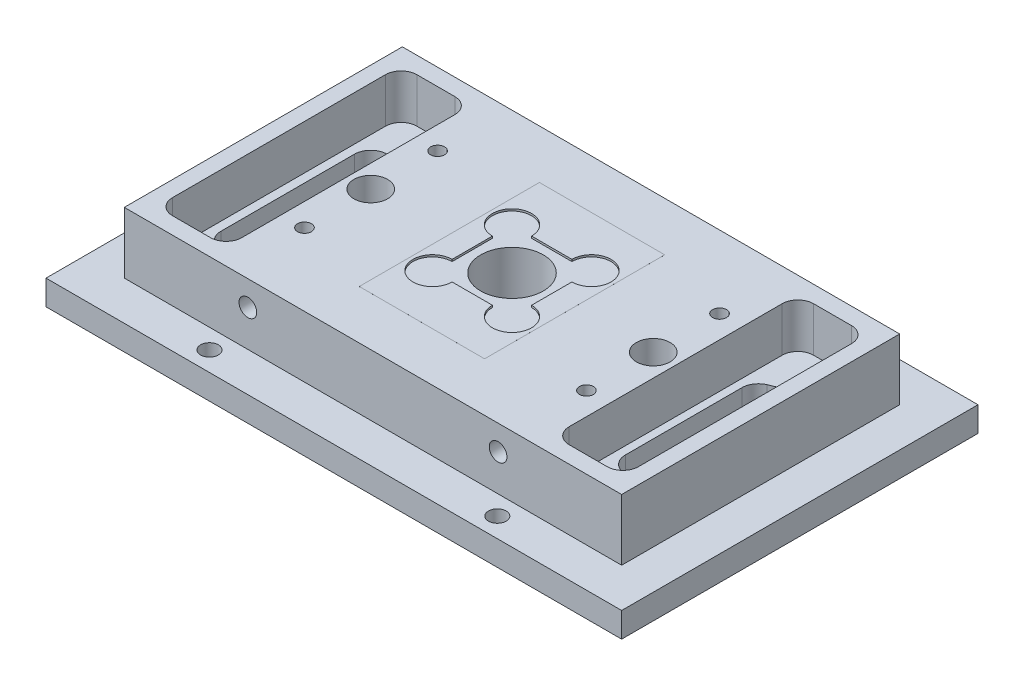
from build123d import *

# Parameters (mm, degrees)
MAIN_SKETCH_W                         = 73.5
MAIN_SKETCH_H                         = 45.5
MAIN_SKETCH_W_2                       = 63.5
MAIN_SKETCH_H_2                       = 35.5
LIP_DEPTH                             = 3.175
MOUNTING_BASE_OUTLINE_W               = 63.5
MOUNTING_BASE_OUTLINE_H               = 35.5
MOUNTING_BASE_OUTLINE_R               = 2.15265
MOUNTING_BASE_OUTLINE_R_2             = 4
MOUNTING_BASE_DEPTH                   = 11
HEATER_CART_4_40_TAPS_D               = 2.2606
HEATER_CART_4_40_TAPS_DEPTH           = 7.595
HEATER_CART_4_40_TAPS_TIP             = 0.679152758
HEATER_CART_4_40_TAPS_ON_FACE_2_D     = 2.2606
HEATER_CART_4_40_TAPS_ON_FACE_2_DEPTH = 7.595
HEATER_CART_4_40_TAPS_ON_FACE_2_TIP   = 0.679152758
MAIN_SKETCH_12_W                      = 8.85
MAIN_SKETCH_12_H                      = 31.2
BOTTOM_SQUARE_CUTOUT_DEPTH            = 2
SQUARE_MICRO_D_CUTOUT_START           = 5.3
SQUARE_MICRO_D_CUTOUT_OUTLINE_W       = 8.85
SQUARE_MICRO_D_CUTOUT_OUTLINE_H       = 31.2
SQUARE_MICRO_D_CUTOUT_DEPTH           = 5.7
MAIN_SKETCH_7_R                       = 0.285
ROUND_MICRO_D_CUTOUT_DEPTH            = 11
INTERNAL_CORNER_CUTOUTS_FILLET_R      = 2
CHIP_CLAMP_0_80_TAPS_AT_2_COUNT       = 2
CHIP_CLAMP_0_80_TAPS_AT_2_PITCH       = 17.1232
CHIP_CLAMP_0_80_TAPS_AT_3_COUNT       = 2
CHIP_CLAMP_0_80_TAPS_AT_3_PITCH       = 17.1232
CHIP_POCKET_START                     = 11
MAIN_SKETCH_6_R                       = 2.5
MAIN_SKETCH_6_W                       = 10.15
MAIN_SKETCH_6_H                       = 10.15
CHIP_POCKET_DEPTH                     = 0.25
F_2_56_CLOSE_CLEAR_43_0_089_D         = 2.2606
PCB_2_56_TAPS_D                       = 1.778
PCB_2_56_TAPS_DEPTH                   = 5.734
PCB_2_56_TAPS_TIP                     = 0.53416509
BOTTOM_COVER_2_56_TAPS_D              = 1.778
BOTTOM_COVER_2_56_TAPS_DEPTH          = 5.734
BOTTOM_COVER_2_56_TAPS_TIP            = 0.53416509
F_2_56_TAPPED_HOLE1_D                 = 1.778
F_2_56_TAPPED_HOLE1_DEPTH             = 5.734
F_2_56_TAPPED_HOLE1_TIP               = 0.53416509
SUPRESS_START                         = 11.001
SKETCH14_W                            = 16
SKETCH14_H                            = 23
SUPRESS_IF_NOT_SIMULATING_DEPTH       = 0.001


# Read off the part's stored shape, not the designer's step: Mounting_Base, Square_Micro_D_Cutout
with BuildPart() as part:
    # Main_Sketch → Lip (new body)
    with BuildSketch(Plane(origin=(0, 0, 0), x_dir=(1, 0, 0), z_dir=(0, 1, 0))):
        with Locations((36.75, -22.75)):
            Rectangle(MAIN_SKETCH_W, MAIN_SKETCH_H)
        with Locations((36.75, -22.75)):
            Rectangle(MAIN_SKETCH_W_2, MAIN_SKETCH_H_2, mode=Mode.SUBTRACT)
    extrude(amount=LIP_DEPTH)

    # Mounting_Base outline → Mounting_Base (add)
    with BuildSketch(Plane(origin=(0, 0, 0), x_dir=(1, 0, 0), z_dir=(0, 1, 0))):
        with Locations((36.75, -22.75)):
            Rectangle(MOUNTING_BASE_OUTLINE_W, MOUNTING_BASE_OUTLINE_H)
        with Locations((18.716, -22.75)):
            Circle(MOUNTING_BASE_OUTLINE_R, mode=Mode.SUBTRACT)
        with Locations((36.75, -22.75)):
            Circle(MOUNTING_BASE_OUTLINE_R_2, mode=Mode.SUBTRACT)
        with Locations((54.784, -22.75)):
            Circle(MOUNTING_BASE_OUTLINE_R, mode=Mode.SUBTRACT)
    extrude(amount=MOUNTING_BASE_DEPTH)

    # Heater_Cart_#4-40_Taps
    with Locations(Plane(origin=(52.725, 7.825, 5), x_dir=(-1, 0, 0), z_dir=(0, 0, -1))):
        with Locations((0, 0), (31.95, 0)):
            Hole(HEATER_CART_4_40_TAPS_D / 2, depth=HEATER_CART_4_40_TAPS_DEPTH)
            with Locations((0, 0, -(HEATER_CART_4_40_TAPS_DEPTH + HEATER_CART_4_40_TAPS_TIP / 2))):  # 118° drill point
                Cone(0, HEATER_CART_4_40_TAPS_D / 2, HEATER_CART_4_40_TAPS_TIP, mode=Mode.SUBTRACT)

    # Heater_Cart_#4-40_Taps on face 2
    with Locations(Plane(origin=(20.775, 7.825, 40.5), x_dir=(1, 0, 0), z_dir=(0, 0, 1))):
        with Locations((0, 0), (31.95, 0)):
            Hole(HEATER_CART_4_40_TAPS_ON_FACE_2_D / 2, depth=HEATER_CART_4_40_TAPS_ON_FACE_2_DEPTH)
            with Locations((0, 0, -(HEATER_CART_4_40_TAPS_ON_FACE_2_DEPTH + HEATER_CART_4_40_TAPS_ON_FACE_2_TIP / 2))):  # 118° drill point
                Cone(0, HEATER_CART_4_40_TAPS_ON_FACE_2_D / 2, HEATER_CART_4_40_TAPS_ON_FACE_2_TIP, mode=Mode.SUBTRACT)

    # Main_Sketch<12> → Bottom_square_cutout (cut)
    with BuildSketch(Plane(origin=(0, 0, 0), x_dir=(1, 0, 0), z_dir=(0, 1, 0))):
        with Locations((11.425, -22.75)):
            Rectangle(MAIN_SKETCH_12_W, MAIN_SKETCH_12_H)
        with BuildLine():
            ThreePointArc((11.021574965, -33.196222286), (9.996212222, -33.351578951), (9.021946869, -32.996175702))
            ThreePointArc((9.021946869, -32.996175702), (8.351632057, -32.244424217), (8.109546604, -31.26675))
            Line((8.109546604, -31.26675), (8.109546604, -14.23325))
            ThreePointArc((8.109546604, -14.23325), (8.351632057, -13.255575783), (9.021946869, -12.503824298))
            ThreePointArc((9.021946869, -12.503824298), (9.996212222, -12.148421049), (11.021574965, -12.303777714))
            Line((11.021574965, -12.303777714), (13.554010046, -13.37581902))
            ThreePointArc((13.554010046, -13.37581902), (14.483840891, -14.148001292), (14.8324534, -15.305291306))
            Line((14.8324534, -15.305291306), (14.8324534, -30.194708694))
            ThreePointArc((14.8324534, -30.194708694), (14.483840891, -31.351998708), (13.554010046, -32.12418098))
            Line((13.554010046, -32.12418098), (11.021574965, -33.196222286))
        make_face(mode=Mode.SUBTRACT)
    bottom_square_cutout = extrude(amount=BOTTOM_SQUARE_CUTOUT_DEPTH, mode=Mode.SUBTRACT)

    # Square_Micro_D_Cutout outline → Square_Micro_D_Cutout (cut)
    with BuildSketch(Plane(origin=(0, 0, 0), x_dir=(1, 0, 0), z_dir=(0, 1, 0)).offset(SQUARE_MICRO_D_CUTOUT_START)):
        with Locations((11.425, -22.75)):
            Rectangle(SQUARE_MICRO_D_CUTOUT_OUTLINE_W, SQUARE_MICRO_D_CUTOUT_OUTLINE_H)
        with BuildLine():
            ThreePointArc((11.021574965, -33.196222286), (9.047492447, -33.013373348), (8.109546604, -31.26675))
            Line((8.109546604, -31.26675), (8.109546604, -14.23325))
            ThreePointArc((8.109546604, -14.23325), (9.047492447, -12.486626652), (11.021574965, -12.303777714))
            Line((11.021574965, -12.303777714), (13.554010046, -13.37581902))
            ThreePointArc((13.554010046, -13.37581902), (14.483840891, -14.148001291), (14.8324534, -15.305291306))
            Line((14.8324534, -15.305291306), (14.8324534, -30.194708694))
            ThreePointArc((14.8324534, -30.194708694), (14.483840891, -31.351998709), (13.554010046, -32.12418098))
            Line((13.554010046, -32.12418098), (11.021574965, -33.196222286))
        make_face(mode=Mode.SUBTRACT)
    square_micro_d_cutout = extrude(amount=SQUARE_MICRO_D_CUTOUT_DEPTH, mode=Mode.SUBTRACT)

    # Main_Sketch<7> → Round_Micro_D_Cutout (cut)
    # profile 1 of 2: a face of its own
    with BuildSketch(Plane(origin=(0, 0, 0), x_dir=(1, 0, 0), z_dir=(0, 1, 0))):
        with BuildLine():
            ThreePointArc((9.021946869, -32.996175702), (8.351632057, -32.244424217), (8.109546604, -31.26675))
            Line((8.109546604, -31.26675), (8.109546604, -14.23325))
            ThreePointArc((8.109546604, -14.23325), (8.351632057, -13.255575783), (9.021946869, -12.503824298))
            ThreePointArc((9.021946869, -12.503824298), (9.996212222, -12.148421049), (11.021574965, -12.303777714))
            Line((11.021574965, -12.303777714), (13.554010046, -13.37581902))
            ThreePointArc((13.554010046, -13.37581902), (14.483840891, -14.148001292), (14.8324534, -15.305291306))
            Line((14.8324534, -15.305291306), (14.8324534, -30.194708694))
            ThreePointArc((14.8324534, -30.194708694), (14.483840891, -31.351998708), (13.554010046, -32.12418098))
            Line((13.554010046, -32.12418098), (11.021574965, -33.196222286))
            ThreePointArc((11.021574965, -33.196222286), (9.996212222, -33.351578951), (9.021946869, -32.996175702))
        make_face()
        with Locations((10.899546604, -22.75)):
            Circle(MAIN_SKETCH_7_R, mode=Mode.SUBTRACT)
    # profile 2 of 2: a face of its own
    with BuildSketch(Plane(origin=(0, 0, 0), x_dir=(1, 0, 0), z_dir=(0, 1, 0))):
        with Locations((10.899546604, -22.75)):
            Circle(MAIN_SKETCH_7_R)
    round_micro_d_cutout = extrude(amount=ROUND_MICRO_D_CUTOUT_DEPTH, mode=Mode.SUBTRACT)

    # MicroD_Mirror: Bottom_square_cutout, Square_Micro_D_Cutout, Round_Micro_D_Cutout across plane
    add(bottom_square_cutout.mirror(Plane(origin=(36.75, 0, 0), x_dir=(0, 0, 1), z_dir=(1, 0, 0))), mode=Mode.SUBTRACT)
    add(square_micro_d_cutout.mirror(Plane(origin=(36.75, 0, 0), x_dir=(0, 0, 1), z_dir=(1, 0, 0))), mode=Mode.SUBTRACT)
    add(round_micro_d_cutout.mirror(Plane(origin=(36.75, 0, 0), x_dir=(0, 0, 1), z_dir=(1, 0, 0))), mode=Mode.SUBTRACT)

    # Internal_Corner_cutouts_fillet
    internal_corner_cutouts_fillet_edges = [part.edges().sort_by_distance(p)[0] for p in [
        (15.85, 8.15, 38.35),
        (7, 8.15, 38.35),
        (7, 8.15, 7.15),
        (15.85, 8.15, 7.15),
        (57.65, 1, 7.15),
        (57.65, 1, 38.35),
        (66.5, 1, 38.35),
        (66.5, 1, 7.15),
        (66.5, 8.15, 7.15),
        (66.5, 8.15, 38.35),
        (57.65, 8.15, 38.35),
        (57.65, 8.15, 7.15),
        (15.85, 1, 38.35),
        (15.85, 1, 7.15),
        (7, 1, 7.15),
        (7, 1, 38.35),
    ]]
    fillet(internal_corner_cutouts_fillet_edges, radius=INTERNAL_CORNER_CUTOUTS_FILLET_R)

    # Sketch3 → Chip_Clamp_#0-80 Taps (revolve, cut)
    with BuildSketch(Plane(origin=(36.75, 11, 31.3116), x_dir=(0, 0, 1), z_dir=(1, 0, 0))):
        Polygon((0, 0), (0, 4.358890611), (0.59563, 4.001), (0.59563, 0), align=None)
    chip_clamp_0_80_taps = revolve(axis=Axis((36.75, 17.35, 31.3116), (0, -1, 0)), mode=Mode.SUBTRACT)

    # Chip_Clamp_#0-80 Taps at 2: Chip_Clamp_#0-80 Taps ×2
    with Locations(*[(0, 0, -i * CHIP_CLAMP_0_80_TAPS_AT_2_PITCH) for i in range(1, CHIP_CLAMP_0_80_TAPS_AT_2_COUNT)]):
        add(chip_clamp_0_80_taps, mode=Mode.SUBTRACT)

    # Chip_Clamp_#0-80 Taps at 3: Chip_Clamp_#0-80 Taps ×2
    with Locations(*[(0, 0, -i * CHIP_CLAMP_0_80_TAPS_AT_3_PITCH) for i in range(1, CHIP_CLAMP_0_80_TAPS_AT_3_COUNT)]):
        add(chip_clamp_0_80_taps, mode=Mode.SUBTRACT)

    # Main_Sketch<6> → Chip_Pocket (cut)
    with BuildSketch(Plane(origin=(0, 0, 0), x_dir=(1, 0, 0), z_dir=(0, 1, 0)).offset(CHIP_POCKET_START)):
        with BuildLine():
            Line((31.675, -20.175), (31.675, -17.675))
            Line((31.675, -17.675), (34.175, -17.675))
            ThreePointArc((34.175, -17.675), (29.907233047, -15.907233047), (31.675, -20.175))
        make_face()
        with BuildLine():
            Line((34.175, -17.675), (31.675, -17.675))
            Line((31.675, -17.675), (31.675, -20.175))
            ThreePointArc((31.675, -20.175), (33.442766953, -19.442766953), (34.175, -17.675))
        make_face()
        with BuildLine():
            ThreePointArc((44.325, -17.675), (41.825, -15.175), (39.325, -17.675))
            Line((39.325, -17.675), (41.825, -17.675))
            Line((41.825, -17.675), (41.825, -20.175))
            ThreePointArc((41.825, -20.175), (43.592766953, -19.442766953), (44.325, -17.675))
        make_face()
        with BuildLine():
            Line((41.825, -17.675), (39.325, -17.675))
            ThreePointArc((39.325, -17.675), (40.057233047, -19.442766953), (41.825, -20.175))
            Line((41.825, -20.175), (41.825, -17.675))
        make_face()
        with BuildLine():
            ThreePointArc((34.175, -27.825), (33.442766953, -26.057233047), (31.675, -25.325))
            Line((31.675, -25.325), (31.675, -27.825))
            Line((31.675, -27.825), (34.175, -27.825))
        make_face()
        with BuildLine():
            Line((31.675, -27.825), (31.675, -25.325))
            ThreePointArc((31.675, -25.325), (29.907233047, -29.592766953), (34.175, -27.825))
            Line((34.175, -27.825), (31.675, -27.825))
        make_face()
        with BuildLine():
            ThreePointArc((44.325, -27.825), (43.592766953, -26.057233047), (41.825, -25.325))
            Line((41.825, -25.325), (41.825, -27.825))
            Line((41.825, -27.825), (39.325, -27.825))
            ThreePointArc((39.325, -27.825), (41.825, -30.325), (44.325, -27.825))
        make_face()
        with BuildLine():
            Line((41.825, -27.825), (41.825, -25.325))
            ThreePointArc((41.825, -25.325), (40.057233047, -26.057233047), (39.325, -27.825))
            Line((39.325, -27.825), (41.825, -27.825))
        make_face()
        with Locations((41.825, -27.825)):
            Circle(MAIN_SKETCH_6_R)
        with Locations((41.825, -17.675)):
            Circle(MAIN_SKETCH_6_R)
        with Locations((31.675, -17.675)):
            Circle(MAIN_SKETCH_6_R)
        with Locations((31.675, -27.825)):
            Circle(MAIN_SKETCH_6_R)
        with Locations((36.75, -22.75)):
            Rectangle(MAIN_SKETCH_6_W, MAIN_SKETCH_6_H)
    extrude(amount=-CHIP_POCKET_DEPTH, mode=Mode.SUBTRACT)

    # 2-56_Close_Clear#43 (0.089) (through all)
    with Locations(Plane(origin=(18.375, 0, 43), x_dir=(0, 0, -1), z_dir=(0, -1, 0))):
        with Locations((0, 0), (40.5, 0), (40.5, 36.75), (0, 36.75)):
            Hole(F_2_56_CLOSE_CLEAR_43_0_089_D / 2)

    # PCB #2-56 Taps
    with Locations(Plane(origin=(18.75, 11, 14.25), x_dir=(0, 0, 1), z_dir=(0, 1, 0))):
        with Locations((0, 0), (17, 0), (0, 36), (17, 36)):
            Hole(PCB_2_56_TAPS_D / 2, depth=PCB_2_56_TAPS_DEPTH)
            with Locations((0, 0, -(PCB_2_56_TAPS_DEPTH + PCB_2_56_TAPS_TIP / 2))):  # 118° drill point
                Cone(0, PCB_2_56_TAPS_D / 2, PCB_2_56_TAPS_TIP, mode=Mode.SUBTRACT)

    # Bottom_Cover#2-56 Taps
    with Locations(Plane(origin=(54.285, 0, 18.78149915), x_dir=(0, 0, -1), z_dir=(0, -1, 0))):
        with Locations((0, 0), (-8, 0), (-8, -36.07), (0, -36.07)):
            Hole(BOTTOM_COVER_2_56_TAPS_D / 2, depth=BOTTOM_COVER_2_56_TAPS_DEPTH)
            with Locations((0, 0, -(BOTTOM_COVER_2_56_TAPS_DEPTH + BOTTOM_COVER_2_56_TAPS_TIP / 2))):  # 118° drill point
                Cone(0, BOTTOM_COVER_2_56_TAPS_D / 2, BOTTOM_COVER_2_56_TAPS_TIP, mode=Mode.SUBTRACT)

    # #2-56 Tapped Hole1
    with Locations(Plane(origin=(32.94, 0, 31.38), x_dir=(0, 0, -1), z_dir=(0, -1, 0))):
        with Locations((0, 0), (-7.62, 0), (-7.62, 7.62), (0, 7.62)):
            Hole(F_2_56_TAPPED_HOLE1_D / 2, depth=F_2_56_TAPPED_HOLE1_DEPTH)
            with Locations((0, 0, -(F_2_56_TAPPED_HOLE1_DEPTH + F_2_56_TAPPED_HOLE1_TIP / 2))):  # 118° drill point
                Cone(0, F_2_56_TAPPED_HOLE1_D / 2, F_2_56_TAPPED_HOLE1_TIP, mode=Mode.SUBTRACT)

    # Sketch14 → SUPRESS IF NOT SIMULATING (add)
    with BuildSketch(Plane(origin=(0, 0, 0), x_dir=(1, 0, 0), z_dir=(0, 1, 0)).offset(SUPRESS_START)):
        with Locations((36.75, -22.75)):
            Rectangle(SKETCH14_W, SKETCH14_H)
        with BuildLine():
            ThreePointArc((31.675, -20.175), (29.907233047, -15.907233047), (34.175, -17.675))
            Line((34.175, -17.675), (39.325, -17.675))
            ThreePointArc((39.325, -17.675), (41.825, -15.175), (44.325, -17.675))
            ThreePointArc((44.325, -17.675), (43.592766953, -19.442766953), (41.825, -20.175))
            Line((41.825, -20.175), (41.825, -25.325))
            ThreePointArc((41.825, -25.325), (43.592766953, -26.057233047), (44.325, -27.825))
            ThreePointArc((44.325, -27.825), (41.825, -30.325), (39.325, -27.825))
            Line((39.325, -27.825), (34.175, -27.825))
            ThreePointArc((34.175, -27.825), (29.907233047, -29.592766953), (31.675, -25.325))
            Line((31.675, -25.325), (31.675, -20.175))
        make_face(mode=Mode.SUBTRACT)
    extrude(amount=-SUPRESS_IF_NOT_SIMULATING_DEPTH)


solid = part.part
